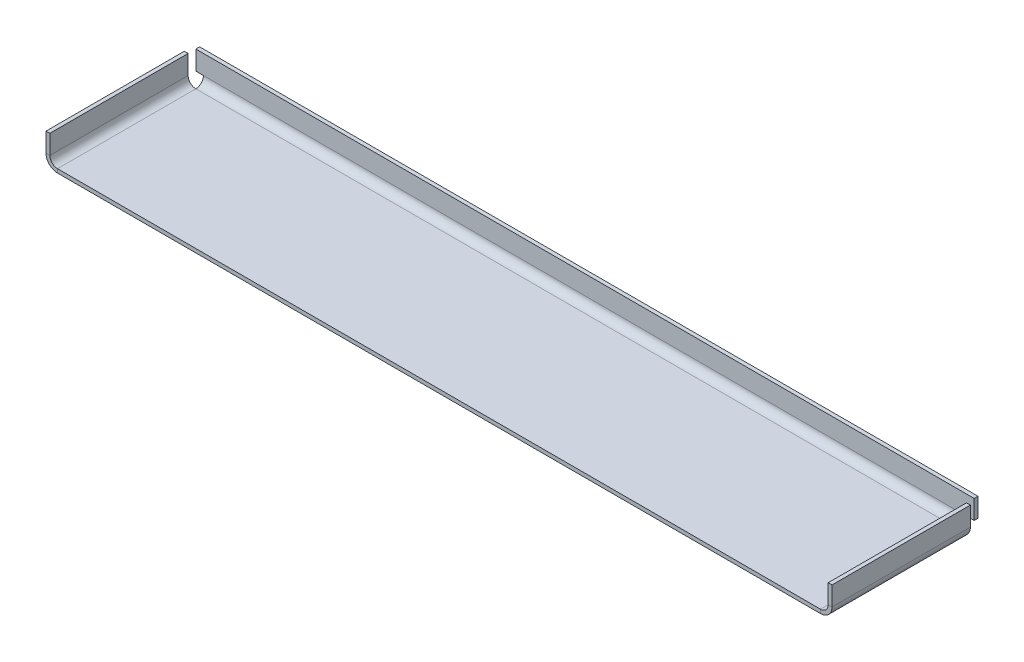
from build123d import *

# Parameters (mm, degrees)
SKETCH1_W                    = 645.65784
SKETCH1_H                    = 121.07672
BASE_FLANGE1_DEPTH           = 3.175
EDGE_FLANGE1_STRIP_W         = 25.4
EDGE_FLANGE1_STRIP_H         = 3.175
EDGE_FLANGE1_STRIP_CUT_DEPTH = 645.65784
EDGE_FLANGE1_DEPTH           = 645.65784
EDGE_FLANGE2_START           = -124.25172
EDGE_FLANGE2_DEPTH           = 124.25172
EDGE_FLANGE2_2_DEPTH         = 9.525
EDGE_FLANGE2_START_2         = -114.72672
EDGE_FLANGE2_3_DEPTH         = 114.72672


# Read off the part's stored shape, not the designer's step: Edge-Flange2
# Sheet-metal steps are written as plain solids
with BuildPart() as part:
    # Sketch1 → Base-Flange1 (new body)
    with BuildSketch(Plane(origin=(0, 0, 0), x_dir=(1, 0, 0), z_dir=(0, 1, 0))):
        with Locations((322.82892, 60.53836)):
            Rectangle(SKETCH1_W, SKETCH1_H)
    extrude(amount=-BASE_FLANGE1_DEPTH)

    # Edge-Flange1 strip (across the edge) → Edge-Flange1 strip cut (cut)
    with BuildSketch(Plane(origin=(645.65784, 0, -121.07672), x_dir=(0, 0, 1), z_dir=(-1, 0, 0))):
        with Locations((-6.35, -1.5875)):
            Rectangle(EDGE_FLANGE1_STRIP_W, EDGE_FLANGE1_STRIP_H)
    extrude(amount=EDGE_FLANGE1_STRIP_CUT_DEPTH, mode=Mode.SUBTRACT)

    # Edge-Flange1 section (across the edge) → Edge-Flange1 (add)
    with BuildSketch(Plane(origin=(645.65784, 0, -121.07672), x_dir=(0, 0, 1), z_dir=(-1, 0, 0))):
        with BuildLine():
            Line((-3.175, 6.35), (-3.175, 22.225))
            Line((-3.175, 22.225), (0, 22.225))
            Line((0, 22.225), (0, 6.35))
            ThreePointArc((0, 6.35), (1.859871939, 1.859871939), (6.35, 0))
            Line((6.35, 0), (6.35, -3.175))
            ThreePointArc((6.35, -3.175), (-0.385192091, -0.385192091), (-3.175, 6.35))
        make_face()
    extrude(amount=EDGE_FLANGE1_DEPTH)

    # Edge-Flange2 outline → Edge-Flange2 (cut)
    with BuildSketch(Plane.XY.offset(EDGE_FLANGE2_START)):
        with BuildLine():
            ThreePointArc((639.30784, 0), (643.797968061, 1.859871939), (645.65784, 6.35))
            Line((645.65784, 6.35), (639.30784, 6.35))
            Line((639.30784, 6.35), (639.30784, 0))
        make_face()
        with BuildLine():
            ThreePointArc((645.65784, -0.749515829), (642.706570405, -2.547991719), (639.30784, -3.175))
            Line((639.30784, -3.175), (645.65784, -3.175))
            Line((645.65784, -3.175), (645.65784, -0.749515829))
        make_face()
        with BuildLine():
            ThreePointArc((0, 6.35), (1.859871939, 1.859871939), (6.35, 0))
            Line((6.35, 0), (6.35, 6.35))
            Line((6.35, 6.35), (0, 6.35))
        make_face()
        with BuildLine():
            Line((0, -3.175), (6.35, -3.175))
            ThreePointArc((6.35, -3.175), (2.951269595, -2.547991719), (0, -0.749515829))
            Line((0, -0.749515829), (0, -3.175))
        make_face()
    extrude(amount=EDGE_FLANGE2_DEPTH, mode=Mode.SUBTRACT)

    # Edge-Flange2 2 outline → Edge-Flange2 2 (cut)
    with BuildSketch(Plane.XY.offset(EDGE_FLANGE2_START)):
        with BuildLine():
            ThreePointArc((645.65784, 6.35), (643.797968061, 1.859871939), (639.30784, 0))
            Line((639.30784, 0), (639.30784, -3.175))
            ThreePointArc((639.30784, -3.175), (642.706570405, -2.547991719), (645.65784, -0.749515829))
            Line((645.65784, -0.749515829), (645.65784, 6.35))
        make_face()
        with BuildLine():
            Line((0, 6.35), (0, -0.749515829))
            ThreePointArc((0, -0.749515829), (2.951269595, -2.547991719), (6.35, -3.175))
            Line((6.35, -3.175), (6.35, 0))
            ThreePointArc((6.35, 0), (1.859871939, 1.859871939), (0, 6.35))
        make_face()
    extrude(amount=EDGE_FLANGE2_2_DEPTH, mode=Mode.SUBTRACT)

    # Edge-Flange2 3 outline → Edge-Flange2 3 (add)
    with BuildSketch(Plane.XY.offset(EDGE_FLANGE2_START_2)):
        with BuildLine():
            Line((639.30784, 0), (645.65784, 0))
            Line((645.65784, 0), (645.65784, -0.749515829))
            ThreePointArc((645.65784, -0.749515829), (648.002935601, 2.461435033), (648.83284, 6.35))
            Line((648.83284, 6.35), (648.83284, 22.225))
            Line((648.83284, 22.225), (645.65784, 22.225))
            Line((645.65784, 22.225), (645.65784, 6.35))
            ThreePointArc((645.65784, 6.35), (643.797968061, 1.859871939), (639.30784, 0))
        make_face()
        with BuildLine():
            Line((0, 0), (6.35, 0))
            ThreePointArc((6.35, 0), (1.859871939, 1.859871939), (0, 6.35))
            Line((0, 6.35), (0, 22.225))
            Line((0, 22.225), (-3.175, 22.225))
            Line((-3.175, 22.225), (-3.175, 6.35))
            ThreePointArc((-3.175, 6.35), (-2.345095601, 2.461435033), (0, -0.749515829))
            Line((0, -0.749515829), (0, 0))
        make_face()
    extrude(amount=EDGE_FLANGE2_3_DEPTH)


solid = part.part
